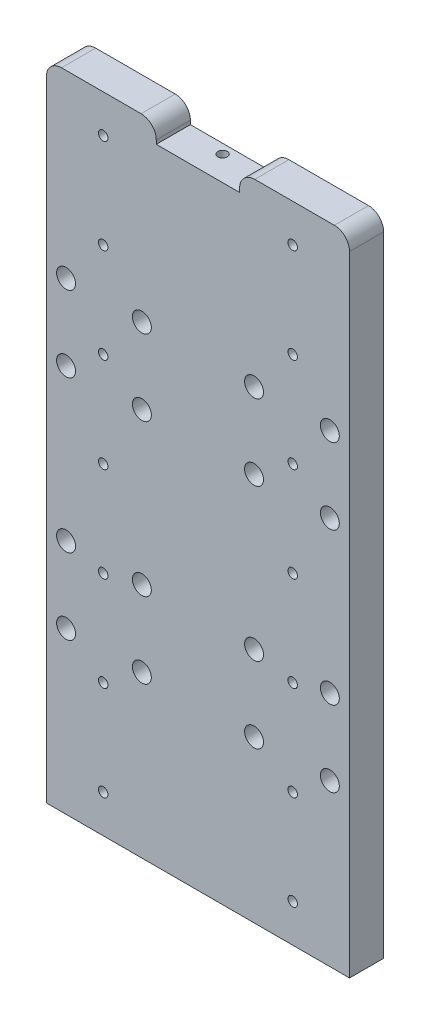
from build123d import *

# Parameters (mm, degrees)
ESQUISSE1_W             = 80
ESQUISSE1_H             = 170
BOSS_EXTRU_1_DEPTH      = 9
ESQUISSE2_R             = 1.25
ENL_V_MAT_EXTRU_1_DEPTH = 189.098378515
ESQUISSE4_W             = 22
ESQUISSE4_H             = 5
ENL_V_MAT_EXTRU_3_DEPTH = 189.098378515
ESQUISSE5_R             = 1.25
ENL_V_MAT_EXTRU_4_DEPTH = 10
ESQUISSE6_R             = 2.5
ENL_V_MAT_EXTRU_5_DEPTH = 189.098378515
CONG_1_R                = 4


with BuildPart() as part:
    # Esquisse1 → Boss.-Extru.1 (new body)
    with BuildSketch(Plane.XY):
        with Locations((40, 85)):
            Rectangle(ESQUISSE1_W, ESQUISSE1_H)
    extrude(amount=BOSS_EXTRU_1_DEPTH)

    # Esquisse2 → Enlèv. mat.-Extru.1 (cut, through all)
    with BuildSketch(Plane.XY.offset(9)):
        with Locations((15, 10)):
            Circle(ESQUISSE2_R)
        with Locations((65, 10)):
            Circle(ESQUISSE2_R)
        with Locations((15, 35)):
            Circle(ESQUISSE2_R)
        with Locations((65, 35)):
            Circle(ESQUISSE2_R)
        with Locations((15, 60)):
            Circle(ESQUISSE2_R)
        with Locations((65, 60)):
            Circle(ESQUISSE2_R)
        with Locations((15, 85)):
            Circle(ESQUISSE2_R)
        with Locations((65, 85)):
            Circle(ESQUISSE2_R)
        with Locations((15, 110)):
            Circle(ESQUISSE2_R)
        with Locations((65, 110)):
            Circle(ESQUISSE2_R)
        with Locations((15, 135)):
            Circle(ESQUISSE2_R)
        with Locations((65, 135)):
            Circle(ESQUISSE2_R)
        with Locations((15, 160)):
            Circle(ESQUISSE2_R)
        with Locations((65, 160)):
            Circle(ESQUISSE2_R)
        with Locations((15, 185)):
            Circle(ESQUISSE2_R)
        with Locations((65, 185)):
            Circle(ESQUISSE2_R)
    extrude(amount=-ENL_V_MAT_EXTRU_1_DEPTH, mode=Mode.SUBTRACT)

    # Esquisse4 → Enlèv. mat.-Extru.3 (cut, through all)
    with BuildSketch(Plane.XY.offset(9)):
        with Locations((40, 167.5)):
            Rectangle(ESQUISSE4_W, ESQUISSE4_H)
    extrude(amount=-ENL_V_MAT_EXTRU_3_DEPTH, mode=Mode.SUBTRACT)

    # Esquisse5 → Enlèv. mat.-Extru.4 (cut)
    with BuildSketch(Plane(origin=(0, 165, 0), x_dir=(1, 0, 0), z_dir=(0, 1, 0))):
        with Locations((40, -2.5)):
            Circle(ESQUISSE5_R)
    extrude(amount=-ENL_V_MAT_EXTRU_4_DEPTH, mode=Mode.SUBTRACT)

    # Esquisse6 → Enlèv. mat.-Extru.5 (cut, through all)
    with BuildSketch(Plane.XY.offset(9)):
        with Locations((74.8, 122.5)):
            Circle(ESQUISSE6_R)
        with Locations((74.8, 62.5)):
            Circle(ESQUISSE6_R)
        with Locations((74.8, 102.5)):
            Circle(ESQUISSE6_R)
        with Locations((74.8, 42.5)):
            Circle(ESQUISSE6_R)
        with Locations((5.2, 42.5)):
            Circle(ESQUISSE6_R)
        with Locations((5.2, 102.5)):
            Circle(ESQUISSE6_R)
        with Locations((5.2, 62.5)):
            Circle(ESQUISSE6_R)
        with Locations((5.2, 122.5)):
            Circle(ESQUISSE6_R)
        with Locations((54.8, 102.5)):
            Circle(ESQUISSE6_R)
        with Locations((54.8, 122.5)):
            Circle(ESQUISSE6_R)
        with Locations((54.8, 42.5)):
            Circle(ESQUISSE6_R)
        with Locations((54.8, 62.5)):
            Circle(ESQUISSE6_R)
        with Locations((25.2, 62.5)):
            Circle(ESQUISSE6_R)
        with Locations((25.2, 42.5)):
            Circle(ESQUISSE6_R)
        with Locations((25.2, 122.5)):
            Circle(ESQUISSE6_R)
        with Locations((25.2, 102.5)):
            Circle(ESQUISSE6_R)
    extrude(amount=-ENL_V_MAT_EXTRU_5_DEPTH, mode=Mode.SUBTRACT)

    # Congé1
    cong_1_edges = [part.edges().sort_by_distance(p)[0] for p in [
        (80, 170, 4.5),
        (0, 170, 4.5),
        (51, 170, 4.5),
        (29, 170, 4.5),
    ]]
    fillet(cong_1_edges, radius=CONG_1_R)


solid = part.part
